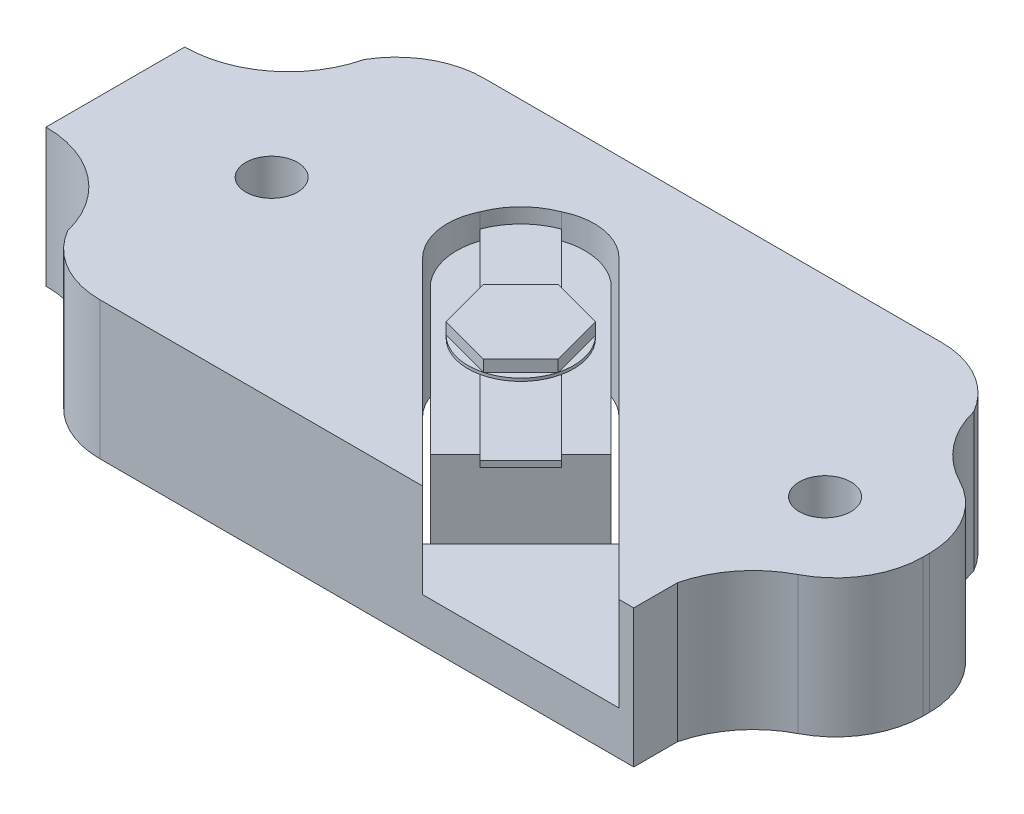
from build123d import *

# Parameters (mm, degrees)
BOSS_EXTRUDE1_DEPTH           = 10.2
BOSS_EXTRUDE2_DEPTH           = 0.5
BOSS_EXTRUDE4_DEPTH           = 0.25
BOSS_EXTRUDE5_DEPTH           = 1.25
BOSS_EXTRUDE6_DEPTH           = 12
CUT_EXTRUDE1_DEPTH            = 41.867802174
CUT_EXTRUDE2_DEPTH            = 8.19
SKETCH10_W                    = 2.25
SKETCH10_H                    = 12
M4_CLEARANCE_HOLE1_AT_2_COUNT = 2
M4_CLEARANCE_HOLE1_AT_2_PITCH = 48.2
FILLET1_R                     = 7.62
FILLET2_R                     = 7.62


with BuildPart() as part:
    # Sketch1 → Boss-Extrude1 (new body)
    with BuildSketch(Plane(origin=(0, 0, 0), x_dir=(1, 0, 0), z_dir=(0, 1, 0))):
        with BuildLine():
            ThreePointArc((-8.273149364, 8.273149316), (-9.899999094, 4.617835693), (-8.66205807, 0.813172798))
            Line((-8.66205807, 0.813172798), (4.348706704, -12.197591975))
            Line((4.348706704, -12.197591975), (12.197591975, -4.348706704))
            Line((12.197591975, -4.348706704), (-0.813172798, 8.66205807))
            ThreePointArc((-0.813172798, 8.66205807), (-4.617835727, 9.899999092), (-8.273149364, 8.273149316))
        make_face()
    extrude(amount=BOSS_EXTRUDE1_DEPTH)

    # Sketch2 → Boss-Extrude2 (add)
    with BuildSketch(Plane(origin=(0, 10.2, 0), x_dir=(1, 0, 0), z_dir=(0, 1, 0))):
        Polygon((-10.995510447, 7.459976542), (7.459976542, -10.995510447), (10.995510447, -7.459976542), (-7.459976542, 10.995510447), align=None)
    extrude(amount=BOSS_EXTRUDE2_DEPTH)



with BuildPart() as body_2:
    # Sketch3 → Boss-Extrude4 (new body)
    with BuildSketch(Plane(origin=(0, 10.7, 0), x_dir=(1, 0, 0), z_dir=(0, 1, 0))):
        with BuildLine():
            Line((2.816913201, -2.816913207), (1.190567607, -4.443258801))
            ThreePointArc((1.190567607, -4.443258801), (3.252691193, -3.252691193), (4.443258801, -1.190567607))
            Line((4.443258801, -1.190567607), (2.816913201, -2.816913207))
        make_face()
        with BuildLine():
            ThreePointArc((-3.252691193, -3.252691193), (-1.303419386, -4.411473439), (0.962617635, -4.498151541))
            Line((0.962617635, -4.498151541), (0.804197277, -4.339731183))
            Line((0.804197277, -4.339731183), (-1.031061719, -3.847975017))
            Line((-1.031061719, -3.847975017), (-3.252691193, -3.252691193))
        make_face()
        with BuildLine():
            Line((0.804197277, -4.339731183), (0.962617635, -4.498151541))
            ThreePointArc((0.962617635, -4.498151541), (1.07694242, -4.472157759), (1.190567607, -4.443258801))
            Line((1.190567607, -4.443258801), (0.804197277, -4.339731183))
        make_face()
        with BuildLine():
            ThreePointArc((-4.443258801, 1.190567607), (-4.472157759, 1.07694242), (-4.498151541, 0.962617635))
            Line((-4.498151541, 0.962617635), (-4.339731183, 0.804197277))
            Line((-4.339731183, 0.804197277), (-4.443258801, 1.190567607))
        make_face()
        with BuildLine():
            Line((-4.339731183, 0.804197277), (-4.498151541, 0.962617635))
            ThreePointArc((-4.498151541, 0.962617635), (-4.411473439, -1.303419386), (-3.252691193, -3.252691193))
            Line((-3.252691193, -3.252691193), (-3.847975039, -1.031061638))
            Line((-3.847975039, -1.031061638), (-4.339731183, 0.804197277))
        make_face()
        with BuildLine():
            ThreePointArc((-1.190567607, 4.443258801), (-3.252691193, 3.252691193), (-4.443258801, 1.190567607))
            Line((-4.443258801, 1.190567607), (-2.816913206, 2.816913202))
            Line((-2.816913206, 2.816913202), (-1.190567607, 4.443258801))
        make_face()
        with BuildLine():
            ThreePointArc((3.252691193, 3.252691193), (1.303419386, 4.411473439), (-0.962617635, 4.498151541))
            Line((-0.962617635, 4.498151541), (-0.804197277, 4.339731183))
            Line((-0.804197277, 4.339731183), (1.03106158, 3.847975054))
            Line((1.03106158, 3.847975054), (3.252691193, 3.252691193))
        make_face()
        with BuildLine():
            Line((-0.804197277, 4.339731183), (-0.962617635, 4.498151541))
            ThreePointArc((-0.962617635, 4.498151541), (-1.07694242, 4.472157759), (-1.190567607, 4.443258801))
            Line((-1.190567607, 4.443258801), (-0.804197277, 4.339731183))
        make_face()
        with BuildLine():
            ThreePointArc((4.443258801, -1.190567607), (4.472157759, -1.07694242), (4.498151541, -0.962617635))
            Line((4.498151541, -0.962617635), (4.339731183, -0.804197277))
            Line((4.339731183, -0.804197277), (4.443258801, -1.190567607))
        make_face()
        with BuildLine():
            Line((4.339731183, -0.804197277), (4.498151541, -0.962617635))
            ThreePointArc((4.498151541, -0.962617635), (4.574467023, -0.483995305), (4.6, 0))
            ThreePointArc((4.6, 0), (4.24984585, 1.760343789), (3.252691193, 3.252691193))
            Line((3.252691193, 3.252691193), (3.847975061, 1.031061553))
            Line((3.847975061, 1.031061553), (4.339731183, -0.804197277))
        make_face()
        with BuildLine():
            ThreePointArc((-3.252691193, -3.252691193), (-1.303419386, -4.411473439), (0.962617635, -4.498151541))
            Line((0.962617635, -4.498151541), (0.804197277, -4.339731183))
            Line((0.804197277, -4.339731183), (-1.031061719, -3.847975017))
            Line((-1.031061719, -3.847975017), (-3.252691193, -3.252691193))
        make_face()
        with BuildLine():
            Line((0.804197277, -4.339731183), (0.962617635, -4.498151541))
            ThreePointArc((0.962617635, -4.498151541), (1.07694242, -4.472157759), (1.190567607, -4.443258801))
            Line((1.190567607, -4.443258801), (0.804197277, -4.339731183))
        make_face()
        with BuildLine():
            ThreePointArc((-4.443258801, 1.190567607), (-4.472157759, 1.07694242), (-4.498151541, 0.962617635))
            Line((-4.498151541, 0.962617635), (-4.339731183, 0.804197277))
            Line((-4.339731183, 0.804197277), (-4.443258801, 1.190567607))
        make_face()
        with BuildLine():
            Line((-4.339731183, 0.804197277), (-4.498151541, 0.962617635))
            ThreePointArc((-4.498151541, 0.962617635), (-4.411473439, -1.303419386), (-3.252691193, -3.252691193))
            Line((-3.252691193, -3.252691193), (-3.847975039, -1.031061638))
            Line((-3.847975039, -1.031061638), (-4.339731183, 0.804197277))
        make_face()
        with BuildLine():
            ThreePointArc((3.252691193, 3.252691193), (1.303419386, 4.411473439), (-0.962617635, 4.498151541))
            Line((-0.962617635, 4.498151541), (-0.804197277, 4.339731183))
            Line((-0.804197277, 4.339731183), (1.03106158, 3.847975054))
            Line((1.03106158, 3.847975054), (3.252691193, 3.252691193))
        make_face()
        with BuildLine():
            Line((-0.804197277, 4.339731183), (-0.962617635, 4.498151541))
            ThreePointArc((-0.962617635, 4.498151541), (-1.07694242, 4.472157759), (-1.190567607, 4.443258801))
            Line((-1.190567607, 4.443258801), (-0.804197277, 4.339731183))
        make_face()
        with BuildLine():
            ThreePointArc((4.443258801, -1.190567607), (4.472157759, -1.07694242), (4.498151541, -0.962617635))
            Line((4.498151541, -0.962617635), (4.339731183, -0.804197277))
            Line((4.339731183, -0.804197277), (4.443258801, -1.190567607))
        make_face()
        with BuildLine():
            Line((4.339731183, -0.804197277), (4.498151541, -0.962617635))
            ThreePointArc((4.498151541, -0.962617635), (4.574467023, -0.483995305), (4.6, 0))
            ThreePointArc((4.6, 0), (4.24984585, 1.760343789), (3.252691193, 3.252691193))
            Line((3.252691193, 3.252691193), (3.847975061, 1.031061553))
            Line((3.847975061, 1.031061553), (4.339731183, -0.804197277))
        make_face()
    extrude(amount=BOSS_EXTRUDE4_DEPTH)


with BuildPart() as part_1:
    add(part.part)

    add(body_2.part)  # Boss-Extrude5 merges body 2
    # Sketch3<3> → Boss-Extrude5 (add)
    with BuildSketch(Plane(origin=(0, 10.7, 0), x_dir=(1, 0, 0), z_dir=(0, 1, 0))):
        Polygon((4.443258801, -1.190567607), (3.252691193, 3.252691193), (-1.190567607, 4.443258801), (-4.443258801, 1.190567607), (-3.252691193, -3.252691193), (1.190567607, -4.443258801), align=None)
    extrude(amount=BOSS_EXTRUDE5_DEPTH)


with BuildPart() as body_2_2:
    # Sketch5 → Boss-Extrude6 (new body)
    with BuildSketch(Plane(origin=(0, 0, 0), x_dir=(1, 0, 0), z_dir=(0, 1, 0))):
        with BuildLine():
            Line((26.551725125, -16.714698757), (26.551725125, -12.904698757))
            ThreePointArc((26.551725125, -12.904698757), (29.746675052, -7.962106389), (35.31, -6.042122046))
            Line((35.31, -6.042122046), (35.31, 6.042122046))
            ThreePointArc((35.31, 6.042122046), (29.746675052, 7.962106389), (26.551725125, 12.904698757))
            Line((26.551725125, 12.904698757), (26.551725125, 16.714698757))
            Line((26.551725125, 16.714698757), (-26.551725125, 16.714698757))
            Line((-26.551725125, 16.714698757), (-26.551725125, 12.904698757))
            ThreePointArc((-26.551725125, 12.904698757), (-29.746675052, 7.962106389), (-35.31, 6.042122046))
            Line((-35.31, 6.042122046), (-35.31, -6.042122046))
            ThreePointArc((-35.31, -6.042122046), (-29.746675052, -7.962106389), (-26.551725125, -12.904698757))
            Line((-26.551725125, -12.904698757), (-26.551725125, -16.714698757))
            Line((-26.551725125, -16.714698757), (26.551725125, -16.714698757))
        make_face()
        with BuildLine():
            Line((-9.033646769, 0.477654716), (-8.66205807, 0.813172798))
            ThreePointArc((-8.66205807, 0.813172798), (-9.8172278, 3.327283506), (-9.622773435, 6.08723953))
            Line((-9.622773435, 6.08723953), (-10.014231548, 6.478697642))
            ThreePointArc((-10.014231548, 6.478697642), (-8.62670273, 8.62670273), (-6.478697642, 10.014231548))
            Line((-6.478697642, 10.014231548), (-6.08723953, 9.622773435))
            ThreePointArc((-6.08723953, 9.622773435), (-3.327283506, 9.8172278), (-0.813172798, 8.66205807))
            Line((-0.813172798, 8.66205807), (-0.477654716, 9.033646769))
            Line((-0.477654716, 9.033646769), (12.904698757, -4.348706704))
            Line((12.904698757, -4.348706704), (4.348706704, -12.904698757))
            Line((4.348706704, -12.904698757), (-9.033646769, 0.477654716))
        make_face(mode=Mode.SUBTRACT)
    extrude(amount=BOSS_EXTRUDE6_DEPTH)

    # Sketch6 → Cut-Extrude1 (cut, through all)
    with BuildSketch(Plane(origin=(0, 12, 0), x_dir=(1, 0, 0), z_dir=(0, 1, 0))):
        with BuildLine():
            ThreePointArc((-9.033646769, 0.477654716), (-10.490761124, 3.320195156), (-10.014231548, 6.478697642))
            Line((-10.014231548, 6.478697642), (-9.622773435, 6.08723953))
            ThreePointArc((-9.622773435, 6.08723953), (-9.8172278, 3.327283506), (-8.66205807, 0.813172798))
            Line((-8.66205807, 0.813172798), (-9.033646769, 0.477654716))
        make_face()
        with BuildLine():
            ThreePointArc((-0.477654716, 9.033646769), (-3.320195156, 10.490761124), (-6.478697642, 10.014231548))
            Line((-6.478697642, 10.014231548), (-6.08723953, 9.622773435))
            ThreePointArc((-6.08723953, 9.622773435), (-3.327283506, 9.8172278), (-0.813172798, 8.66205807))
            Line((-0.813172798, 8.66205807), (-0.477654716, 9.033646769))
        make_face()
    extrude(amount=-CUT_EXTRUDE1_DEPTH, mode=Mode.SUBTRACT)

    # Sketch8 → Cut-Extrude2 (cut)
    with BuildSketch(Plane(origin=(0, 12, 0), x_dir=(1, 0, 0), z_dir=(0, 1, 0))):
        Polygon((12.904698757, -4.348706704), (4.348706704, -12.904698757), (8.158706704, -16.714698757), (25.270690809, -16.714698757), align=None)
    extrude(amount=-CUT_EXTRUDE2_DEPTH, mode=Mode.SUBTRACT)

    # Sketch10 → M4 Clearance Hole1 (revolve, cut)
    with BuildSketch(Plane(origin=(26.5, 0, 0), x_dir=(0, 0, -1), z_dir=(1, 0, 0))):
        with Locations((1.125, 6)):
            Rectangle(SKETCH10_W, SKETCH10_H)
    m4_clearance_hole1 = revolve(axis=Axis((26.5, -6.35, 0), (0, 1, 0)), mode=Mode.SUBTRACT)

    # M4 Clearance Hole1 at 2: M4 Clearance Hole1 ×2
    with Locations(*[(-i * M4_CLEARANCE_HOLE1_AT_2_PITCH, 0, 0) for i in range(1, M4_CLEARANCE_HOLE1_AT_2_COUNT)]):
        add(m4_clearance_hole1, mode=Mode.SUBTRACT)

    # Fillet1
    fillet1_edges = [body_2_2.edges().sort_by_distance(p)[0] for p in [
        (35.31, 6, -6.042122046),
        (35.31, 6, 6.042122046),
    ]]
    fillet(fillet1_edges, radius=FILLET1_R)

    # Fillet2
    # the kernel refuses this fillet: 7.62 mm, written as the material it takes off along each edge
    with BuildSketch(Plane(origin=(-26.551725125, -16.497783942, 16.714698757), x_dir=(1, 0, 0), z_dir=(0, 1, 0))) as fillet2_piece_1:
        with BuildLine():
            CenterArc((6.599113577, 7.62), FILLET2_R, 210, 60)
            Line((0, 3.81), (-0.131982272, 3.7338))
            ThreePointArc((-0.131982272, 3.7338), (-0.1524, 1.905), (-0.1524, 0))
            Line((-0.1524, 0), (0, -0.1524))
            Line((0, -0.1524), (6.599113577, -0.1524))
            Line((6.599113577, -0.1524), (6.599113577, 0))
        make_face()
    extrude(amount=44.995567884, mode=Mode.SUBTRACT)
    with BuildSketch(Plane(origin=(-26.551725125, -16.497783942, -16.714698757), x_dir=(1, 0, 0), z_dir=(0, 1, 0))) as fillet2_piece_2:
        with BuildLine():
            CenterArc((6.599113577, -7.62), FILLET2_R, 90, 60)
            Line((0, -3.81), (-0.131982272, -3.7338))
            ThreePointArc((-0.131982272, -3.7338), (-0.1524, -1.905), (-0.1524, 0))
            Line((-0.1524, 0), (0, 0.1524))
            Line((0, 0.1524), (6.599113577, 0.1524))
            Line((6.599113577, 0.1524), (6.599113577, 0))
        make_face()
    extrude(amount=44.995567884, mode=Mode.SUBTRACT)
    with BuildSketch(Plane(origin=(26.551725125, -16.497783942, -16.714698757), x_dir=(0, 0, 1), z_dir=(0, 1, 0))) as fillet2_piece_3:
        with BuildLine():
            CenterArc((7.62, -6.599113577), FILLET2_R, 120, 60)
            Line((0, -6.599113577), (-0.1524, -6.599113577))
            Line((-0.1524, -6.599113577), (-0.1524, 0))
            Line((-0.1524, 0), (0, 0.1524))
            ThreePointArc((0, 0.1524), (1.905, 0.1524), (3.7338, 0.131982272))
            Line((3.7338, 0.131982272), (3.81, 0))
        make_face()
    extrude(amount=44.995567884, mode=Mode.SUBTRACT)


solid = Compound([part_1.part, body_2_2.part])
